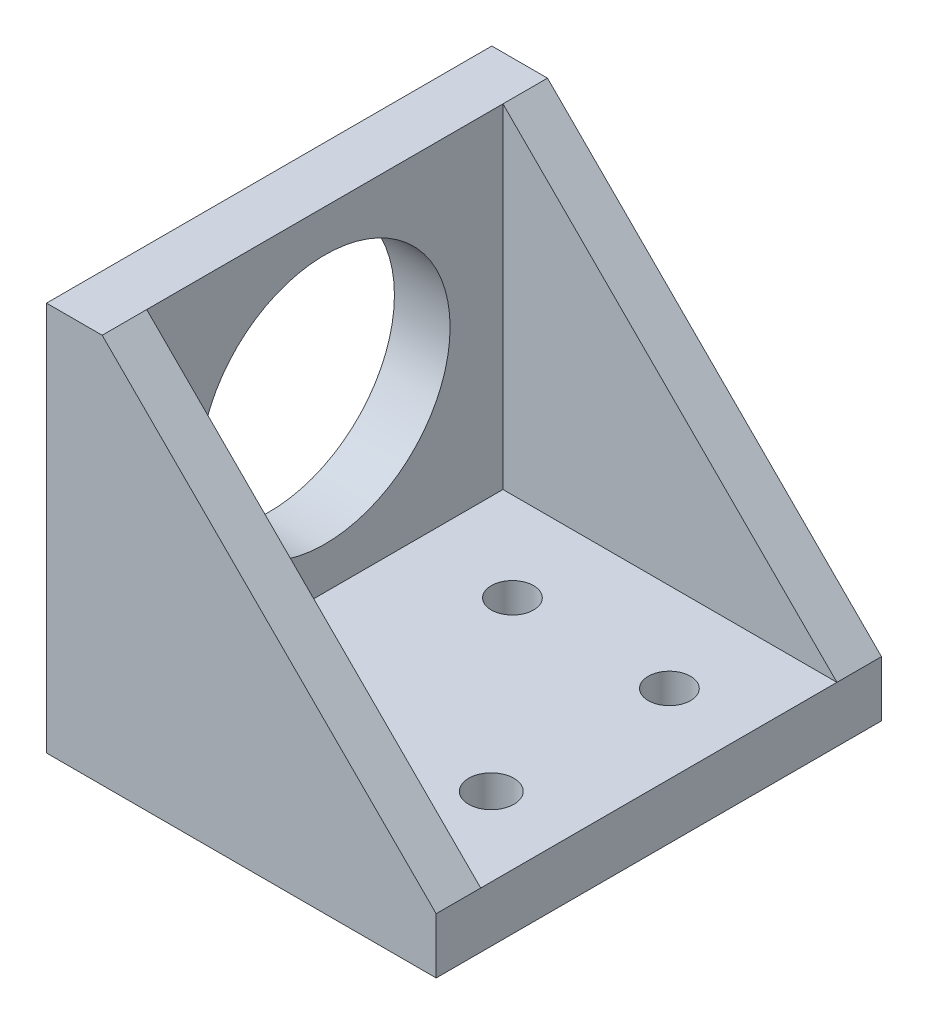
from build123d import *

# Parameters (mm, degrees)
SKETCH1_W           = 50.8
SKETCH1_H           = 6.35
BOSS_EXTRUDE1_DEPTH = 38.1
SKETCH1_3_W         = 50.8
SKETCH1_3_H         = 38.1
SKETCH1_3_R         = 14.2875
BOSS_EXTRUDE2_DEPTH = 6.35
SKETCH3_W           = 6.35
SKETCH3_H           = 50.8
BOSS_EXTRUDE3_DEPTH = 6.35
BOSS_EXTRUDE4_DEPTH = 5.08
BOSS_EXTRUDE5_DEPTH = 5.08
SKETCH6_R           = 2.413
SKETCH6_R_2         = 2.5796875
CUT_EXTRUDE1_DEPTH  = 60.56828015


with BuildPart() as part:
    # Sketch1 → Boss-Extrude1 (new body)
    with BuildSketch(Plane(origin=(0, 0, 0), x_dir=(0, 0, -1), z_dir=(1, 0, 0))):
        with Locations((0, -22.225)):
            Rectangle(SKETCH1_W, SKETCH1_H)
    extrude(amount=BOSS_EXTRUDE1_DEPTH)



with BuildPart() as body_2:
    # Sketch1<3> → Boss-Extrude2 (new body)
    with BuildSketch(Plane(origin=(0, 0, 0), x_dir=(0, 0, -1), z_dir=(1, 0, 0))):
        Rectangle(SKETCH1_3_W, SKETCH1_3_H)
        Circle(SKETCH1_3_R, mode=Mode.SUBTRACT)
    extrude(amount=-BOSS_EXTRUDE2_DEPTH)


with BuildPart() as part_1:
    add(part.part)

    add(body_2.part)  # Boss-Extrude3 merges body 2
    # Sketch3 → Boss-Extrude3 (add)
    with BuildSketch(Plane.XZ.offset(19.05)):
        with Locations((-3.175, 0)):
            Rectangle(SKETCH3_W, SKETCH3_H)
    extrude(amount=BOSS_EXTRUDE3_DEPTH)

    # Sketch4 → Boss-Extrude4 (add)
    with BuildSketch(Plane.XY.offset(25.4)):
        Polygon((0, 19.05), (38.1, -19.05), (0, -19.05), align=None)
    extrude(amount=-BOSS_EXTRUDE4_DEPTH)

    # Sketch5 → Boss-Extrude5 (add)
    with BuildSketch(Plane(origin=(0, 0, -25.4), x_dir=(-1, 0, 0), z_dir=(0, 0, -1))):
        Polygon((0, 19.05), (-38.1, -19.05), (0, -19.05), align=None)
    extrude(amount=-BOSS_EXTRUDE5_DEPTH)

    # Sketch6 → Cut-Extrude1 (cut, through all)
    with BuildSketch(Plane(origin=(0, -19.05, 0), x_dir=(1, 0, 0), z_dir=(0, 1, 0))):
        with Locations((11.2395, 10.16)):
            Circle(SKETCH6_R)
        with Locations((29.1465, 10.16)):
            Circle(SKETCH6_R)
        with Locations((11.2395, -10.16)):
            Circle(SKETCH6_R)
        with Locations((29.1465, -10.16)):
            Circle(SKETCH6_R_2)
    extrude(amount=-CUT_EXTRUDE1_DEPTH, mode=Mode.SUBTRACT)


solid = part_1.part
